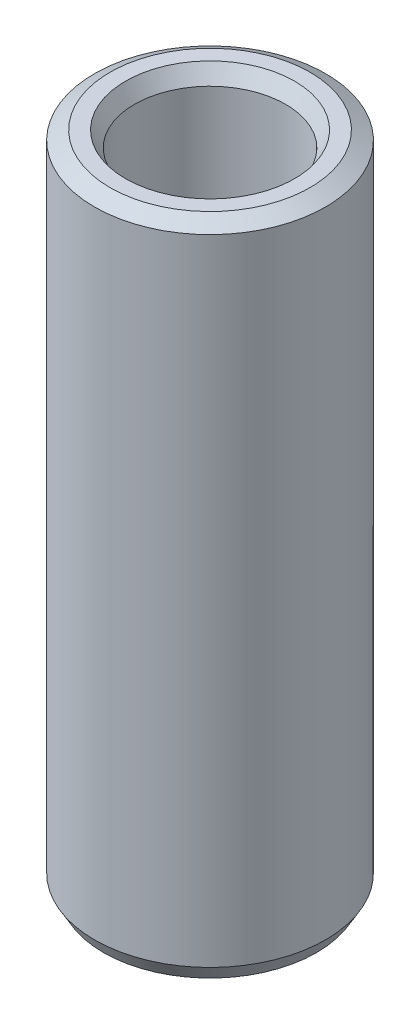
from build123d import *
from OCP.BRepFilletAPI import BRepFilletAPI_MakeChamfer

# Parameters (mm, degrees)
SKETCH1_R           = 42.5
BOSS_EXTRUDE1_DEPTH = 242.450909699
SKETCH2_R           = 27.786801202
CUT_EXTRUDE1_DEPTH  = 250.789798859
CHAMFER1_SIZE       = 3.303942923
CHAMFER1_SIZE2      = 5.722597008


with BuildPart() as part:
    # Sketch1 → Boss-Extrude1 (new body)
    with BuildSketch(Plane(origin=(0, 0, 0), x_dir=(1, 0, 0), z_dir=(0, 1, 0))):
        Circle(SKETCH1_R)
    extrude(amount=BOSS_EXTRUDE1_DEPTH)

    # Sketch2 → Cut-Extrude1 (cut, through all)
    with BuildSketch(Plane(origin=(0, 0, 0), x_dir=(1, 0, 0), z_dir=(0, 1, 0))):
        Circle(SKETCH2_R)
    extrude(amount=CUT_EXTRUDE1_DEPTH, mode=Mode.SUBTRACT)

    # Chamfer1: one chamfer whose edges measure the first distance from different faces: ONE call of the kernel's chamfer builder (chamfer() names one face for all edges)
    chamfer1_edges_1 = [part.edges().sort_by_distance(p)[0] for p in [
        (-27.786801202, 242.450909699, 0),
    ]]
    chamfer1_side_1 = [part.faces().sort_by_distance(p)[0] for p in [
        (-41.297918472, 242.450909699, 0),
    ]]
    chamfer1_edges_2 = [part.edges().sort_by_distance(p)[0] for p in [
        (-27.786801202, 0, 0),
    ]]
    chamfer1_side_2 = [part.faces().sort_by_distance(p)[0] for p in [
        (-27.786801202, 121.22545485, 0),
    ]]
    chamfer1_edges_3 = [part.edges().sort_by_distance(p)[0] for p in [
        (-42.5, 0, 0),
    ]]
    chamfer1_side_3 = [part.faces().sort_by_distance(p)[0] for p in [
        (-41.297918472, 0, 0),
    ]]
    chamfer1_edges_4 = [part.edges().sort_by_distance(p)[0] for p in [
        (-42.5, 242.450909699, 0),
    ]]
    chamfer1_side_4 = [part.faces().sort_by_distance(p)[0] for p in [
        (-42.5, 121.22545485, 0),
    ]]
    chamfer1 = BRepFilletAPI_MakeChamfer(part.part.solid().wrapped)
    for e in chamfer1_edges_1:
        chamfer1.Add(CHAMFER1_SIZE, CHAMFER1_SIZE2, e.wrapped, chamfer1_side_1[0].wrapped)  # the first distance lies on this face
    for e in chamfer1_edges_2:
        chamfer1.Add(CHAMFER1_SIZE, CHAMFER1_SIZE2, e.wrapped, chamfer1_side_2[0].wrapped)  # the first distance lies on this face
    for e in chamfer1_edges_3:
        chamfer1.Add(CHAMFER1_SIZE, CHAMFER1_SIZE2, e.wrapped, chamfer1_side_3[0].wrapped)  # the first distance lies on this face
    for e in chamfer1_edges_4:
        chamfer1.Add(CHAMFER1_SIZE, CHAMFER1_SIZE2, e.wrapped, chamfer1_side_4[0].wrapped)  # the first distance lies on this face
    add(Compound.cast(chamfer1.Shape()), mode=Mode.REPLACE)


solid = part.part
